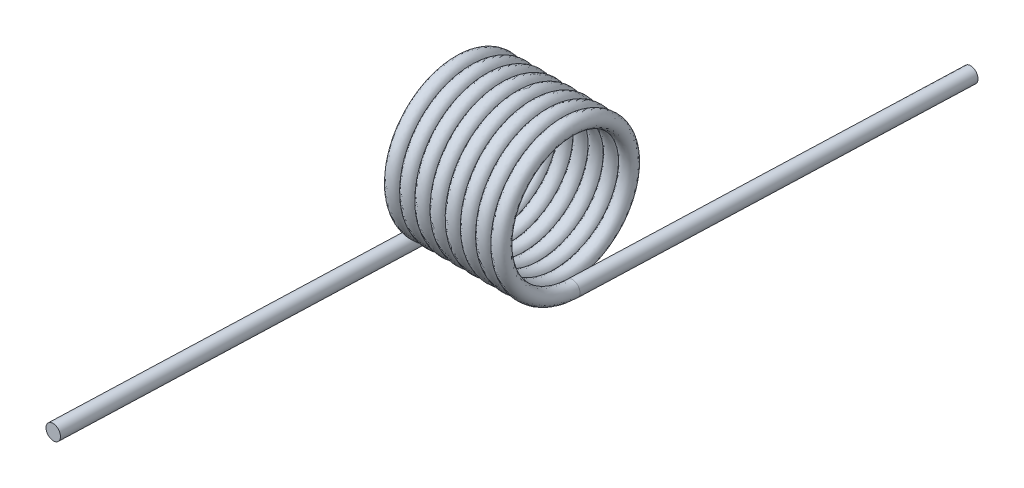
from build123d import *

# Parameters (mm, degrees)
SWEEP1_PITCH   = 2.0066
SKETCH3_R      = 0.9906
EXTRUDE1_DEPTH = 50.8
SKETCH4_R      = 0.9906
EXTRUDE2_DEPTH = 50.8


with BuildPart() as part:
    # Sweep1: the profile of Sketch2 screwed along a right-hand helix of 8 turns, 6 arcs to a turn; built about Z, then put on its axis
    sweep1_z = Axis((0, 0, 0), (0, 0, 1))
    sweep1_corners = [(8.9281, 0.035411356, -0.989966866), (7.9375, 0, 0), (8.9281, -0.035411356, 0.989966866), (9.9187, 0, 0)]
    with BuildLine(mode=Mode.PRIVATE) as sweep1_profile:
        ThreePointArc((8.9281, 0.035411356, -0.989966866), (8.227640023, 0.02503961, -0.700012284), (7.9375, 0, 0))
        ThreePointArc((7.9375, 0, 0), (8.227640023, -0.02503961, 0.700012284), (8.9281, -0.035411356, 0.989966866))
        ThreePointArc((8.9281, -0.035411356, 0.989966866), (9.628559977, -0.02503961, 0.700012284), (9.9187, 0, 0))
        ThreePointArc((9.9187, 0, 0), (9.628559977, 0.02503961, -0.700012284), (8.9281, 0.035411356, -0.989966866))
    sweep1_cap = Face(sweep1_profile.wire())
    sweep1_arcs = [((8.9281, 0.035411356, -0.989966866), (7.9375, 0.035411356, -0.989966866), (7.9375, 0, 0), (1, 0.7071067811865476, 1)), ((7.9375, 0, 0), (7.9375, -0.035411356, 0.989966866), (8.9281, -0.035411356, 0.989966866), (1, 0.7071067811865476, 1)), ((8.9281, -0.035411356, 0.989966866), (9.9187, -0.035411356, 0.989966866), (9.9187, 0, 0), (1, 0.7071067811865476, 1)), ((9.9187, 0, 0), (9.9187, 0.035411356, -0.989966866), (8.9281, 0.035411356, -0.989966866), (1, 0.7071067811865476, 1))]  # start, shoulder, end, weights
    sweep1_turn_angles = [0, 30, 60, 90, 120, 150, 180, 210, 240, 270, 300, 330, 360]
    sweep1_turn_weights = [1, 0.8660254037844387, 1, 0.8660254037844387, 1, 0.8660254037844387, 1, 0.8660254037844387, 1, 0.8660254037844387, 1, 0.8660254037844387, 1]
    sweep1_turn_sides = [Face.make_bezier_surface([[Vector(p[j][0], p[j][1], 0).rotate(sweep1_z, sweep1_turn_angles[2 * i + k]) / sweep1_turn_weights[2 * i + k] + Vector(0, 0, p[j][2] + SWEEP1_PITCH * sweep1_turn_angles[2 * i + k] / 360) for k in range(3)] for j in range(3)], [[p[3][j] * sweep1_turn_weights[2 * i + k] for k in range(3)] for j in range(3)]) for p in sweep1_arcs for i in range(6)]
    sweep1 = Plane(origin=(0, 0, 0), x_dir=(0, -1, 0), z_dir=(1, 0, 0)) * Solid(Shell([*[p.moved(Location((0, 0, SWEEP1_PITCH * i))) for i in range(8) for p in sweep1_turn_sides], sweep1_cap, sweep1_cap.rotate(sweep1_z, 2880).moved(Location((0, 0, SWEEP1_PITCH * 2880 / 360)))]))
    add(sweep1)

    # Sketch3 → Extrude1 (add)
    with BuildSketch(Plane(origin=(0, 0, 0), x_dir=(0.9993608581248304, -2.6746581226614135e-14, 0.0357473809950124), z_dir=(-0.0357473809950124, -1.0450655343002762e-14, 0.9993608581248304))):
        with Locations(Location((0, -8.9281, 0), (0, 0, 180))):
            Circle(SKETCH3_R)
    extrude(amount=EXTRUDE1_DEPTH)

    # Sketch4 → Extrude2 (add)
    with BuildSketch(Plane(origin=(0.020513476, 0, -0.573478789), x_dir=(-0.9956925121056559, -0.08560321398081515, -0.035616163365572134), z_dir=(0.03574738099501239, 1.2210675179313843e-13, -0.9993608581248304))):
        with Locations(Location((-15.219378704, -10.268620677, 0), (0, 0, 4.910712917))):
            Circle(SKETCH4_R)
    extrude(amount=EXTRUDE2_DEPTH)


solid = part.part
